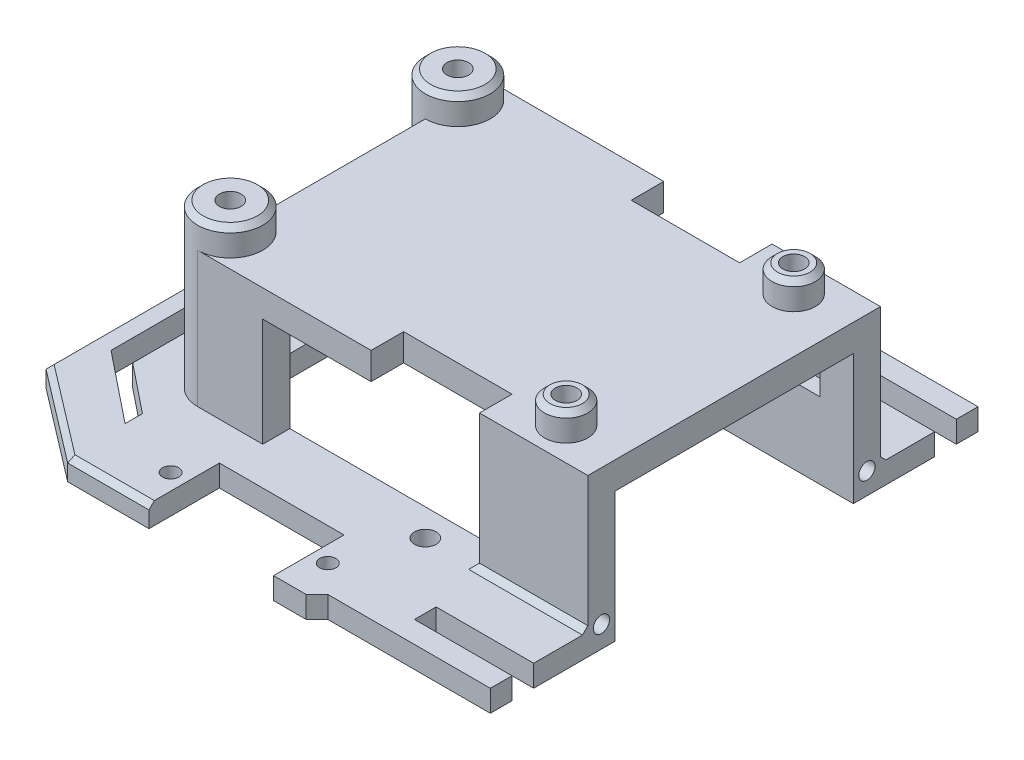
from build123d import *

# Parameters (mm, degrees)
EXTRUDE_1_DEPTH                = 4
CUT_EXTRUDE_1_DEPTH            = 105.27847333
CUT_EXTRUDE_1_DEPTH_BACK       = 105.27847333
SKETCH_2_R                     = 2
SKETCH_2_W                     = 4
SKETCH_2_H                     = 16
CHAMFER_1_SIZE                 = 1
CUT_EXTRUDE_2_DEPTH            = 105.27847333
CUT_EXTRUDE_2_DEPTH_BACK       = 105.27847333
SKETCH_6_W                     = 20
SKETCH_6_H                     = 5
EXTRUDE_2_DEPTH                = 25
CHAMFER_2_SIZE                 = 1
EXTRUDE_START                  = -5
EXTRUDE_3_DEPTH                = 5
SKETCH_8_R                     = 6
EXTRUDE_4_DEPTH                = 5
CHAMFER_3_SIZE                 = 1
SKETCH_9_R                     = 4
EXTRUDE_5_DEPTH                = 5
CUT_EXTRUDE_START              = -10
SKETCH_10_R                    = 2
CUT_EXTRUDE_3_DEPTH            = 120.608393839
HOLE_WIZARD_1_4_0_15748031_1_D = 3.999999874
SKETCH_13_R                    = 1.5
CUT_EXTRUDE_4_DEPTH            = 109.434311913
SKETCH_14_R                    = 2
CUT_EXTRUDE_5_DEPTH            = 109.434311913
CUT_EXTRUDE_START_2            = 10
SKETCH_15_R                    = 4
CUT_EXTRUDE_6_DEPTH            = 10
CHAMFER_4_SIZE                 = 2
CHAMFER_5_SIZE                 = 1
SKETCH_16_W                    = 18
SKETCH_16_H                    = 4
CUT_EXTRUDE_7_DEPTH            = 109.434311913
SKETCH_17_R                    = 1.5
CUT_EXTRUDE_8_DEPTH            = 3


with BuildPart() as part:
    # 草图1 → 凸台-拉伸1 (new body)
    with BuildSketch(Plane(origin=(0, 0, 0), x_dir=(1, 0, 0), z_dir=(0, 1, 0))):
        Polygon((0, -34), (0, 34), (17, 47), (32, 47), (32, 34), (55, 34), (55, 47), (61, 47), (63, 45), (93, 45), (93, -45), (63, -45), (61, -47), (55, -47), (55, -34), (32, -34), (32, -47), (17, -47), align=None)
    extrude(amount=EXTRUDE_1_DEPTH)

    # 草图2 → 切除-拉伸1 (cut, two sides: drawn at the far end of the back side and taken through both)
    with BuildSketch(Plane(origin=(0, 4, 0), x_dir=(1, 0, 0), z_dir=(0, 1, 0)).offset(-CUT_EXTRUDE_1_DEPTH_BACK)):
        with Locations(Location((13, 10, 0), (0, 0, 270))):
            Circle(SKETCH_2_R)
        with Locations(Location((13, -10, 0), (0, 0, 90))):
            Circle(SKETCH_2_R)
        with Locations((6, 0)):
            Rectangle(SKETCH_2_W, SKETCH_2_H)
        Polygon((4, 12), (4, 26), (17, 36.408329997), (17, 33.205766921), (8, 26), (8, 12), align=None)
        Polygon((8, -26), (8, -12), (4, -12), (4, -26), (17, -36.408329997), (17, -33.205766921), align=None)
    extrude(amount=CUT_EXTRUDE_1_DEPTH + CUT_EXTRUDE_1_DEPTH_BACK, mode=Mode.SUBTRACT)

    # 倒角1
    chamfer_1_edges = [part.edges().sort_by_distance(p)[0] for p in [
        (8.5, 4, 40.5),
        (24.5, 4, 47),
        (8.5, 4, -40.5),
        (24.5, 4, -47),
        (0, 4, 0),
    ]]
    chamfer(chamfer_1_edges, length=CHAMFER_1_SIZE)

    # 草图3 → 切除-拉伸2 (cut, two sides: drawn at the far end of the back side and taken through both)
    with BuildSketch(Plane(origin=(0, 4, 0), x_dir=(1, 0, 0), z_dir=(0, 1, 0)).offset(-CUT_EXTRUDE_2_DEPTH_BACK)):
        Polygon((93, 22), (33, 22), (21, 10), (21, -10), (33, -22), (93, -22), align=None)
    extrude(amount=CUT_EXTRUDE_2_DEPTH + CUT_EXTRUDE_2_DEPTH_BACK, mode=Mode.SUBTRACT)

    # 草图6 → 凸台-拉伸2 (add)
    with BuildSketch(Plane(origin=(0, 4, 0), x_dir=(1, 0, 0), z_dir=(0, 1, 0))):
        with BuildLine():
            Line((21, 10), (21, 15))
            ThreePointArc((21, 15), (15, 21), (21, 27))
            Line((21, 27), (33, 27))
            Line((33, 27), (33, 22))
            Line((33, 22), (21, 10))
        make_face()
        with Locations((83, 24.5)):
            Rectangle(SKETCH_6_W, SKETCH_6_H)
    extrude_2 = extrude(amount=EXTRUDE_2_DEPTH)

    # 镜向1: 凸台-拉伸2 across plane
    add(extrude_2.mirror(Plane.XY))

    # 倒角2
    chamfer_2_edges = [part.edges().sort_by_distance(p)[0] for p in [
        (83, 4, -27),
        (73, 4, -24.5),
        (83, 4, 27),
        (73, 4, 24.5),
    ]]
    chamfer(chamfer_2_edges, length=CHAMFER_2_SIZE)

    # 草图7 → 凸台-拉伸3 (add)
    with BuildSketch(Plane(origin=(0, 29, 0), x_dir=(1, 0, 0), z_dir=(0, 1, 0)).offset(EXTRUDE_START)):
        with BuildLine():
            Line((93, 22), (93, 27))
            Line((93, 27), (73, 27))
            Line((73, 27), (73, 21))
            Line((73, 21), (53, 21))
            Line((53, 21), (53, 27))
            Line((53, 27), (33, 27))
            Line((33, 27), (21, 27))
            ThreePointArc((21, 27), (15, 21), (21, 15))
            Line((21, 15), (21, 10))
            Line((21, 10), (21, -10))
            Line((21, -10), (21, -15))
            ThreePointArc((21, -15), (15, -21), (21, -27))
            Line((21, -27), (33, -27))
            Line((33, -27), (53, -27))
            Line((53, -27), (53, -21))
            Line((53, -21), (73, -21))
            Line((73, -21), (73, -27))
            Line((73, -27), (93, -27))
            Line((93, -27), (93, -22))
            Line((93, -22), (93, 22))
        make_face()
    extrude(amount=EXTRUDE_3_DEPTH)

    # 草图8 → 凸台-拉伸4 (add)
    with BuildSketch(Plane(origin=(0, 29, 0), x_dir=(1, 0, 0), z_dir=(0, 1, 0))):
        with Locations(Location((21, 21, 0), (0, 0, 270))):
            Circle(SKETCH_8_R)
        with Locations(Location((21, -21, 0), (0, 0, 270))):
            Circle(SKETCH_8_R)
    extrude(amount=EXTRUDE_4_DEPTH)

    # 倒角3
    chamfer_3_edges = [part.edges().sort_by_distance(p)[0] for p in [
        (21, 34, -27),
        (21, 34, 15),
    ]]
    chamfer(chamfer_3_edges, length=CHAMFER_3_SIZE)

    # 草图9 → 凸台-拉伸5 (add)
    with BuildSketch(Plane(origin=(0, 29, 0), x_dir=(1, 0, 0), z_dir=(0, 1, 0))):
        with Locations(Location((83, 21, 0), (0, 0, 270))):
            Circle(SKETCH_9_R)
    extrude_5 = extrude(amount=EXTRUDE_5_DEPTH)

    # 草图10 → 切除-拉伸3 (cut)
    with BuildSketch(Plane(origin=(0, 34, 0), x_dir=(1, 0, 0), z_dir=(0, 1, 0)).offset(CUT_EXTRUDE_START)):
        with Locations(Location((83, 21, 0), (0, 0, 270))):
            Circle(SKETCH_10_R)
    cut_extrude_3 = extrude(amount=CUT_EXTRUDE_3_DEPTH, mode=Mode.SUBTRACT)

    # 镜向2: 凸台-拉伸5, 切除-拉伸3 across plane
    add(extrude_5.mirror(Plane.XY))
    add(cut_extrude_3.mirror(Plane.XY), mode=Mode.SUBTRACT)

    # 1/4 (0.15748031) 直径孔1 (through all)
    with Locations(Plane(origin=(21, 34, -21), x_dir=(0, 0, 1), z_dir=(0, 1, 0))):
        with Locations((0, 0)):
            hole_wizard_1_4_0_15748031_1 = Hole(HOLE_WIZARD_1_4_0_15748031_1_D / 2)

    # 镜向3: 1/4 (0.15748031) 直径孔1 across plane
    add(hole_wizard_1_4_0_15748031_1.mirror(Plane.XY), mode=Mode.SUBTRACT)

    # 草图13 → 切除-拉伸4 (cut, symmetric)
    with BuildSketch(Plane(origin=(0, 4, 0), x_dir=(1, 0, 0), z_dir=(0, 1, 0))):
        with Locations(Location((29, 40, 0), (0, 0, 270))):
            Circle(SKETCH_13_R)
        with Locations(Location((58, 40, 0), (0, 0, 270))):
            Circle(SKETCH_13_R)
    cut_extrude_4 = extrude(amount=CUT_EXTRUDE_4_DEPTH, both=True, mode=Mode.SUBTRACT)

    # 镜向4: 切除-拉伸4 across plane
    add(cut_extrude_4.mirror(Plane.XY), mode=Mode.SUBTRACT)

    # 草图14 → 切除-拉伸5 (cut, symmetric)
    with BuildSketch(Plane(origin=(0, 4, 0), x_dir=(1, 0, 0), z_dir=(0, 1, 0))):
        with Locations(Location((63, 27, 0), (0, 0, 270))):
            Circle(SKETCH_14_R)
    cut_extrude_5 = extrude(amount=CUT_EXTRUDE_5_DEPTH, both=True, mode=Mode.SUBTRACT)

    # 镜向5: 切除-拉伸5 across plane
    add(cut_extrude_5.mirror(Plane.XY), mode=Mode.SUBTRACT)

    # 草图15 → 切除-拉伸6 (cut)
    with BuildSketch(Plane.XZ.offset(-24).offset(CUT_EXTRUDE_START_2)):
        with Locations(Location((83, 21, 0), (0, 0, 270))):
            Circle(SKETCH_15_R)
        with Locations(Location((83, -21, 0), (0, 0, 90))):
            Circle(SKETCH_15_R)
    extrude(amount=-CUT_EXTRUDE_6_DEPTH, mode=Mode.SUBTRACT)

    # 倒角4
    chamfer_4_edges = [part.edges().sort_by_distance(p)[0] for p in [
        (83, 24, -23),
        (83, 24, 23),
    ]]
    chamfer(chamfer_4_edges, length=CHAMFER_4_SIZE - 0.0001)  # a hair under: the kernel refuses the full size

    # 倒角5
    chamfer_5_edges = [part.edges().sort_by_distance(p)[0] for p in [
        (83, 34, -25),
        (83, 34, 25),
    ]]
    chamfer(chamfer_5_edges, length=CHAMFER_5_SIZE)

    # 草图16 → 切除-拉伸7 (cut, through all)
    with BuildSketch(Plane(origin=(0, 4, 0), x_dir=(1, 0, 0), z_dir=(0, 1, 0))):
        with Locations((84, 39)):
            Rectangle(SKETCH_16_W, SKETCH_16_H)
    cut_extrude_7 = extrude(amount=-CUT_EXTRUDE_7_DEPTH, mode=Mode.SUBTRACT)

    # 镜向6: 切除-拉伸7 across plane
    add(cut_extrude_7.mirror(Plane.XY), mode=Mode.SUBTRACT)

    # 草图17 → 切除-拉伸8 (cut)
    with BuildSketch(Plane(origin=(93, 0, 0), x_dir=(0, 0, -1), z_dir=(1, 0, 0))):
        with Locations((24.5, 4)):
            Circle(SKETCH_17_R)
    cut_extrude_8 = extrude(amount=-CUT_EXTRUDE_8_DEPTH, mode=Mode.SUBTRACT)

    # 镜向7: 切除-拉伸8 across plane
    add(cut_extrude_8.mirror(Plane.XY), mode=Mode.SUBTRACT)


solid = part.part
